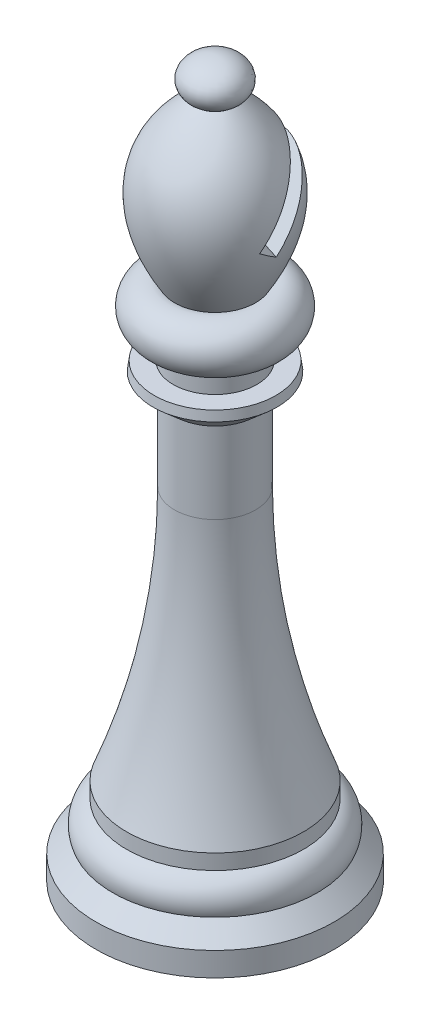
from build123d import *
from OCP.BRepAlgoAPI import BRepAlgoAPI_Cut
from OCP.TopTools import TopTools_ListOfShape

# Parameters (mm, degrees)
CUT_EXTRUDE1_DEPTH      = 5.842
CUT_EXTRUDE1_DEPTH_BACK = 7.112


with BuildPart() as part:
    # Sketch1 → Revolve1 (revolve)
    with BuildSketch(Plane.XY):
        with BuildLine():
            Line((0, 0), (6.35, 0))
            Line((6.35, 0), (6.35, 1.27))
            Line((6.35, 1.27), (5.451974388, 2.168025612))
            ThreePointArc((5.451974388, 2.168025612), (5.425268168, 3.139674583), (4.719324443, 3.807850011))
            Line((4.719324443, 3.807850011), (4.719324443, 4.618157389))
            add(Edge.make_bspline(
                [(4.719324443, 4.618157389), (2.191207341, 11.149425628), (2.162945217, 18.210926818)],
                knots=[0, 0, 0, 1, 1, 1], degree=2))
            Line((2.162945217, 18.210926818), (2.162945217, 22.528926818))
            Line((2.162945217, 22.528926818), (3.311767534, 23.530317493))
            Line((3.311767534, 23.530317493), (3.242795694, 24.033613514))
            Line((3.242795694, 24.033613514), (2.230740911, 24.033613514))
            Line((2.230740911, 24.033613514), (2.230740911, 25.303613514))
            ThreePointArc((2.230740911, 25.303613514), (3.755743451, 26.582465667), (2.162945217, 27.77581782))
            add(Edge.make_bspline(
                [(1.000273268, 36.229714038), (5.275414498, 32.931450332), (2.162945217, 27.77581782)],
                knots=[0, 0, 0, 1, 1, 1], degree=2))
            add(Edge.make_bspline(
                [(1.000273268, 36.229714038), (4.067898527, 38.111819372), (0, 38.111819372)],
                knots=[5.428894031, 5.428894031, 5.428894031, 7.853981634, 7.853981634, 7.853981634], degree=2, weights=[1, 0.35063824, 1]))
            Line((0, 38.111819372), (0, 38.1))
            Line((0, 38.1), (0, 0))
        make_face()
    revolve(axis=Axis((0, 0, 0), (0, 1, 0)))


with BuildPart() as cut_extrude1_tool:
    # Sketch3 → Cut-Extrude1 (new, two sides: drawn at the far end of the back side and taken through both)
    with BuildSketch(Plane(origin=(-3.227609174, 24.033613514, -0.313469186), x_dir=(-0.29997267443447917, 0, 0.9539477944796696), z_dir=(-0.9539477944796697, 0, -0.29997267443447917)).offset(-CUT_EXTRUDE1_DEPTH_BACK)):
        with BuildLine():
            Line((-3.24447126, 10.581689828), (-0.778987351, 7.036762029))
            Line((-0.778987351, 7.036762029), (-1.61308801, 6.456648169))
            Line((-1.61308801, 6.456648169), (-3.788514988, 9.584525638))
            ThreePointArc((-3.788514988, 9.584525638), (-3.824633805, 10.251226491), (-3.24447126, 10.581689828))
        make_face()
    extrude(amount=CUT_EXTRUDE1_DEPTH + CUT_EXTRUDE1_DEPTH_BACK)


with BuildPart() as part_1:
    add(part.part)

    # Cut-Extrude1: cut by cut_extrude1_tool, with a tolerance
    cut_extrude1_stock = TopTools_ListOfShape()
    cut_extrude1_stock.Append(part_1.part.wrapped)
    cut_extrude1_tools = TopTools_ListOfShape()
    cut_extrude1_tools.Append(cut_extrude1_tool.part.wrapped)
    cut_extrude1_cut = BRepAlgoAPI_Cut()
    cut_extrude1_cut.SetArguments(cut_extrude1_stock)
    cut_extrude1_cut.SetTools(cut_extrude1_tools)
    cut_extrude1_cut.SetFuzzyValue(0.00001)
    cut_extrude1_cut.Build()
    add(Compound.cast(cut_extrude1_cut.Shape()).solids(), mode=Mode.REPLACE)


solid = part_1.part
